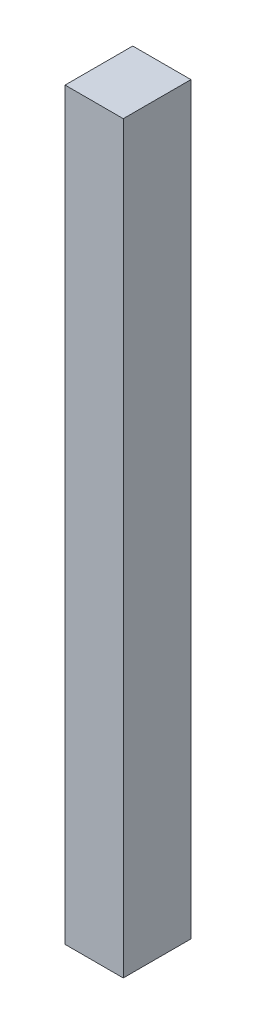
from build123d import *

# Parameters (mm, degrees)
SKETCH1_W           = 25.4
SKETCH1_H           = 50.8
BOSS_EXTRUDE1_DEPTH = 558.8
SKETCH2_R           = 6.35
BOSS_EXTRUDE2_DEPTH = 6.35
SKETCH3_W           = 50.8
SKETCH3_H           = 558.8
BOSS_EXTRUDE3_DEPTH = 18.288


with BuildPart() as part:
    # Sketch1 → Boss-Extrude1 (new body)
    with BuildSketch(Plane(origin=(0, 0, 0), x_dir=(1, 0, 0), z_dir=(0, 1, 0))):
        with Locations((12.7, 25.4)):
            Rectangle(SKETCH1_W, SKETCH1_H)
    extrude(amount=BOSS_EXTRUDE1_DEPTH)

    # Sketch2 → Boss-Extrude2 (add)
    with BuildSketch(Plane(origin=(0, 0, -50.8), x_dir=(-1, 0, 0), z_dir=(0, 0, -1))):
        with Locations((-12.7, 546.1)):
            Circle(SKETCH2_R)
    extrude(amount=BOSS_EXTRUDE2_DEPTH)

    # Sketch3 → Boss-Extrude3 (add)
    with BuildSketch(Plane.ZY):
        with Locations((-25.4, 279.4)):
            Rectangle(SKETCH3_W, SKETCH3_H)
    extrude(amount=BOSS_EXTRUDE3_DEPTH)


solid = part.part
